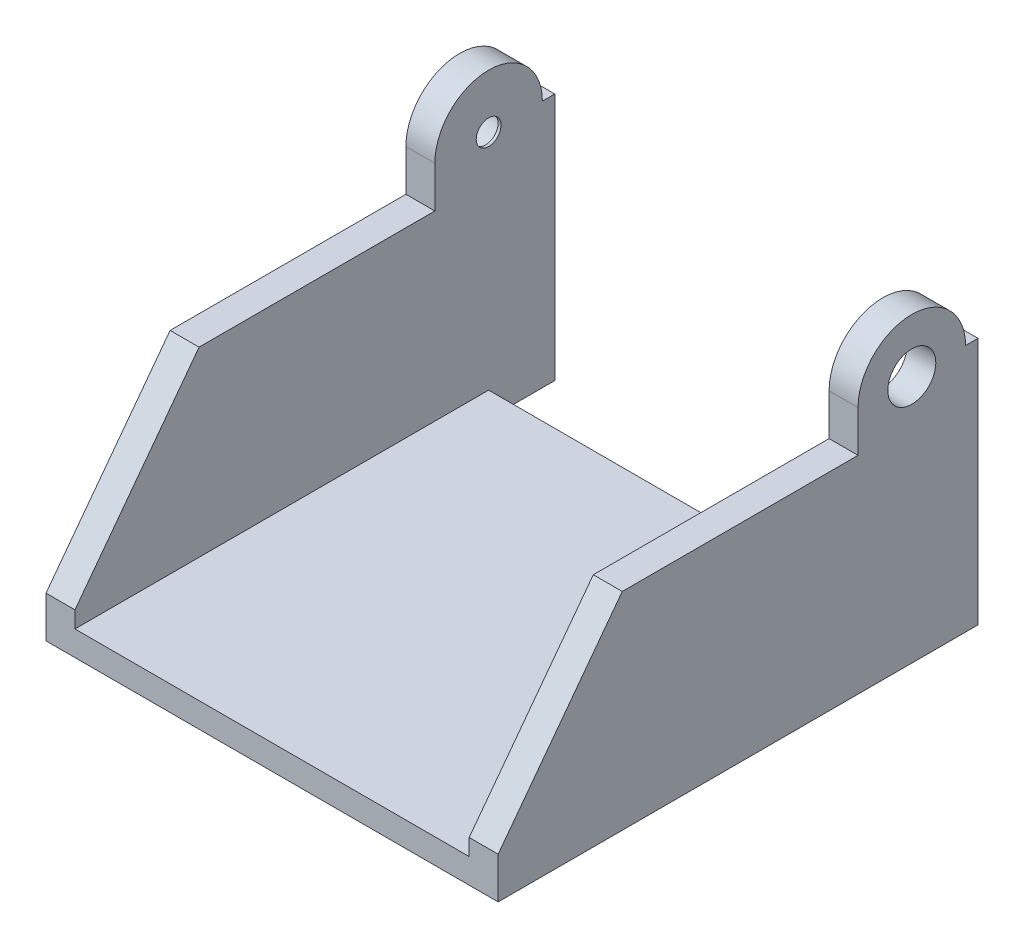
from build123d import *
from build123d.topology import SkipClean

# Parameters (mm, degrees)
BOSS_EXTRUDE1_DEPTH     = 50
BOSS_EXTRUDE2_DEPTH     = 3.5
SKETCH3_R               = 1.5
CUT_EXTRUDE1_DEPTH      = 65.394531018
CUT_EXTRUDE2_DEPTH      = 80.916346888
CUT_EXTRUDE2_DEPTH_BACK = 3.15
SKETCH4_R               = 2.5
SKETCH5_R               = 2.9
CUT_EXTRUDE3_DEPTH      = 7.15
CUT_EXTRUDE4_DEPTH      = 7.15


with BuildPart() as part:
    # Sketch1 → Boss-Extrude1 (new body)
    with BuildSketch(Plane.XY):
        Polygon((-23.825, -27), (-23.825, 0), (-27.325, 0), (-27.325, -30), (0, -30), (0, -27), align=None)
    boss_extrude1 = extrude(amount=BOSS_EXTRUDE1_DEPTH)

    # Sketch2 → Boss-Extrude2 (add)
    with BuildSketch(Plane(origin=(-23.825, 0, 0), x_dir=(0, 0, -1), z_dir=(1, 0, 0))):
        with BuildLine():
            ThreePointArc((-1.5, 0), (1.060660172, 1.060660172), (0, -1.5))
            Line((0, -1.5), (0, -30))
            Line((0, -30), (8, -30))
            Line((8, -30), (8, 0))
            Line((8, 0), (6.5, 0))
            ThreePointArc((6.5, 0), (0, 6.5), (-6.5, 0))
            Line((-6.5, 0), (-1.5, 0))
        make_face()
    boss_extrude2 = extrude(amount=-BOSS_EXTRUDE2_DEPTH)

    # Sketch3 → Cut-Extrude1 (cut, symmetric)
    with BuildSketch(Plane.ZY.offset(27.325)):
        Circle(SKETCH3_R)
    cut_extrude1 = extrude(amount=CUT_EXTRUDE1_DEPTH, both=True, mode=Mode.SUBTRACT)

    # Mirror1: Boss-Extrude1, Boss-Extrude2, Cut-Extrude1 across plane
    with SkipClean():  # the faces are left unmerged after this step: merging them gives an invalid solid
        add(boss_extrude1.mirror(Plane(origin=(0, 0, 50), x_dir=(0, 0, 1), z_dir=(-1, 0, 0))))
        add(boss_extrude2.mirror(Plane(origin=(0, 0, 50), x_dir=(0, 0, 1), z_dir=(-1, 0, 0))))
        add(cut_extrude1.mirror(Plane(origin=(0, 0, 50), x_dir=(0, 0, 1), z_dir=(-1, 0, 0))), mode=Mode.SUBTRACT)

    # Sketch4 → Cut-Extrude2 (cut, two sides: drawn at the far end of the back side and taken through both)
    with SkipClean():  # the faces are left unmerged after this step: merging them gives an invalid solid
        with BuildSketch(Plane.ZY.offset(27.325).offset(-CUT_EXTRUDE2_DEPTH_BACK)):
            Circle(SKETCH4_R)
        extrude(amount=CUT_EXTRUDE2_DEPTH + CUT_EXTRUDE2_DEPTH_BACK, mode=Mode.SUBTRACT)

    # Sketch5 → Cut-Extrude3 (cut)
    with BuildSketch(Plane(origin=(27.325, 0, 0), x_dir=(0, 0, -1), z_dir=(1, 0, 0))):
        Circle(SKETCH5_R)
    extrude(amount=-CUT_EXTRUDE3_DEPTH, mode=Mode.SUBTRACT)

    # Sketch6 → Cut-Extrude4 (cut)
    with BuildSketch(Plane.ZY.offset(27.325)):
        Polygon((50, -10), (50, 0), (25, 0), (6.5, 0), (6.5, -5), (35, -5), (50, -25), align=None)
    cut_extrude4 = extrude(amount=-CUT_EXTRUDE4_DEPTH, mode=Mode.SUBTRACT)

    # Mirror2: Cut-Extrude4 across plane
    add(cut_extrude4.mirror(Plane(origin=(0, 0, 0), x_dir=(0, 0, 1), z_dir=(1, 0, 0))), mode=Mode.SUBTRACT)


solid = part.part
